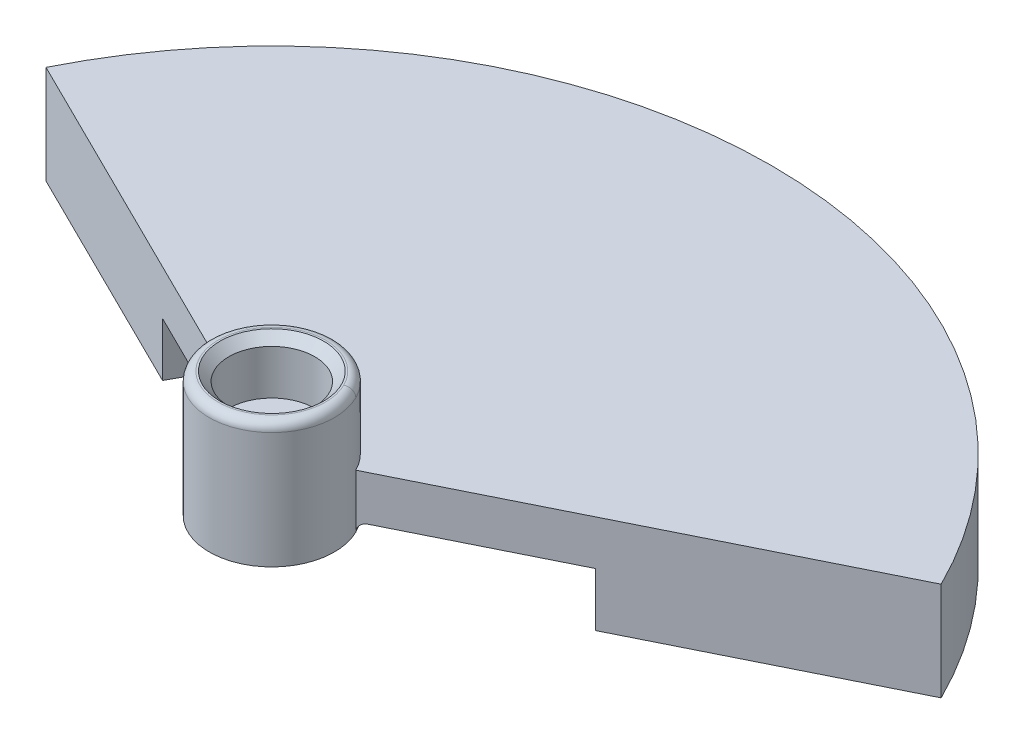
from build123d import *
from build123d.topology import SkipClean

# Parameters (mm, degrees)
SKETCH1_R                = 3.5
SKETCH1_R_2              = 2.5
BOSS_EXTRUDE1_DEPTH      = 3
SKETCH2_R                = 3.5
BOSS_EXTRUDE2_DEPTH      = 1
CUT_EXTRUDE1_REACH       = 8.364
SKETCH3_R                = 1.3
SKETCH4_R                = 3.5
SKETCH4_R_2              = 2.4
BOSS_EXTRUDE3_DEPTH      = 3
CHAMFER1_SIZE            = 0.5
BOSS_EXTRUDE5_DEPTH      = 3.5
BOSS_EXTRUDE5_DEPTH_BACK = 3
FILLET1_R                = 0.5
BOSS_EXTRUDE6_START      = 3
BOSS_EXTRUDE6_DEPTH      = 3
CUT_EXTRUDE2_START       = -4
CUT_EXTRUDE2_DEPTH       = 4
FILLET3_R                = 0.5


# Some blends are built 0.0001 mm under size
with BuildPart() as part:
    # Sketch1 → Boss-Extrude1 (new body)
    with BuildSketch(Plane(origin=(0, 0, 0), x_dir=(1, 0, 0), z_dir=(0, 1, 0))):
        with Locations(Location((0, 0, 0), (0, 0, 270))):
            Circle(SKETCH1_R)
        with Locations(Location((0, 0, 0), (0, 0, 270))):
            Circle(SKETCH1_R_2, mode=Mode.SUBTRACT)
    extrude(amount=BOSS_EXTRUDE1_DEPTH)

    # Sketch2 → Boss-Extrude2 (add)
    with BuildSketch(Plane(origin=(0, 3, 0), x_dir=(1, 0, 0), z_dir=(0, 1, 0))):
        with Locations(Location((0, 0, 0), (0, 0, 270))):
            Circle(SKETCH2_R)
    extrude(amount=BOSS_EXTRUDE2_DEPTH)

    # Sketch3 → Cut-Extrude1 (cut, up to next)
    with BuildSketch(Plane(origin=(0, 4, 0), x_dir=(1, 0, 0), z_dir=(0, 1, 0)), mode=Mode.PRIVATE) as cut_extrude1_sk1:
        with Locations(Location((0, 0, 0), (0, 0, 270))):
            Circle(SKETCH3_R)
    cut_extrude1_tool1 = extrude(cut_extrude1_sk1.sketch, amount=-CUT_EXTRUDE1_REACH, mode=Mode.PRIVATE) & part.part
    add(cut_extrude1_tool1.solids().sort_by_distance((0, 4, 0))[0], mode=Mode.SUBTRACT)

    # Sketch4 → Boss-Extrude3 (add)
    with BuildSketch(Plane(origin=(0, 4, 0), x_dir=(1, 0, 0), z_dir=(0, 1, 0))):
        with Locations(Location((0, 0, 0), (0, 0, 270))):
            Circle(SKETCH4_R)
        with Locations(Location((0, 0, 0), (0, 0, 270))):
            Circle(SKETCH4_R_2, mode=Mode.SUBTRACT)
    extrude(amount=BOSS_EXTRUDE3_DEPTH)

    # Chamfer1
    chamfer1_edges = [part.edges().sort_by_distance(p)[0] for p in [
        (0, 7, -2.4),
        (0, 0, -2.5),
    ]]
    chamfer(chamfer1_edges, length=CHAMFER1_SIZE)

    # Sketch6 → Boss-Extrude5 (add, two sides: drawn at the far end of the back side and taken through both)
    with BuildSketch(Plane(origin=(0, 3.5, 0), x_dir=(1, 0, 0), z_dir=(0, 1, 0)).offset(-BOSS_EXTRUDE5_DEPTH_BACK)):
        with BuildLine():
            Line((-25, 12.385879056), (-3.136200717, 1.553784111))
            ThreePointArc((-3.136200717, 1.553784111), (0, 3.5), (3.136200717, 1.553784111))
            Line((3.136200717, 1.553784111), (25, 12.385879056))
            ThreePointArc((25, 12.385879056), (0, 27.9), (-25, 12.385879056))
        make_face()
    extrude(amount=BOSS_EXTRUDE5_DEPTH + BOSS_EXTRUDE5_DEPTH_BACK)

    # Fillet1
    fillet1_edges = [part.edges().sort_by_distance(p)[0] for p in [
        (-2.973906891, 7, 1.845502047),
        (0, 0.5, -3.5),
    ]]
    fillet(fillet1_edges, radius=FILLET1_R - 0.0001)  # a hair under: the kernel refuses the full size

    # Sketch7 → Boss-Extrude6 (add)
    with BuildSketch(Plane.XZ.offset(-0.5).offset(BOSS_EXTRUDE6_START)):
        with BuildLine():
            Line((25, -12.385879056), (12.096774194, -5.993167285))
            ThreePointArc((12.096774194, -5.993167285), (0, -13.5), (-12.096774194, -5.993167285))
            Line((-12.096774194, -5.993167285), (-25, -12.385879056))
            ThreePointArc((-25, -12.385879056), (0, -27.9), (25, -12.385879056))
        make_face()
    extrude(amount=-BOSS_EXTRUDE6_DEPTH)

    # Sketch8 → Cut-Extrude2 (cut)
    with SkipClean():  # the faces are left unmerged after this step: merging them gives an invalid solid
        with BuildSketch(Plane(origin=(0, 7, 0), x_dir=(1, 0, 0), z_dir=(0, 1, 0)).offset(CUT_EXTRUDE2_START)):
            with BuildLine():
                Line((3.136200717, 1.553784111), (25, 12.385879056))
                ThreePointArc((25, 12.385879056), (0, 27.9), (-25, 12.385879056))
                Line((-25, 12.385879056), (-3.136200717, 1.553784111))
                ThreePointArc((-3.136200717, 1.553784111), (0, 3.5), (3.136200717, 1.553784111))
            make_face()
        extrude(amount=CUT_EXTRUDE2_DEPTH, mode=Mode.SUBTRACT)

    # Fillet3
    # the kernel refuses this fillet: 0.5 mm, written as the material it takes off along each edge
    with BuildSketch(Plane(origin=(0, 7, 0), x_dir=(-0.8960573476702508, 0, -0.44393831743402734), z_dir=(-0.44393831743402734, 0, 0.8960573476702508))) as fillet3_piece_1:
        with BuildLine():
            CenterArc((3.5 - FILLET3_R, FILLET3_R), FILLET3_R, 270, 90)
            Line((3.5, FILLET3_R), (3.5 + FILLET3_R * 0.02, FILLET3_R))
            Line((3.5 + FILLET3_R * 0.02, FILLET3_R), (3.5 + FILLET3_R * 0.02, -FILLET3_R * 0.02))
            Line((3.5 + FILLET3_R * 0.02, -FILLET3_R * 0.02), (3.5 - FILLET3_R, -FILLET3_R * 0.02))
            Line((3.5 - FILLET3_R, -FILLET3_R * 0.02), (3.5 - FILLET3_R, 0))
        make_face()
    revolve(axis=Axis((0, 7, 0), (0, -1, 0)), revolution_arc=127.289134778, mode=Mode.SUBTRACT)


solid = part.part
